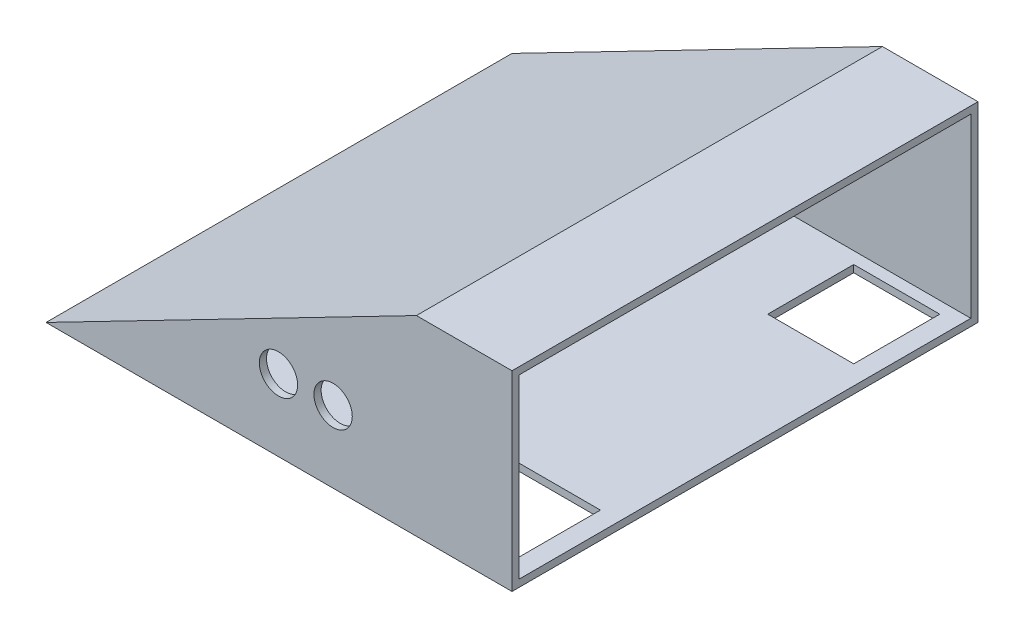
from build123d import *

# Parameters (mm, degrees)
ROBOT_DEPTH                 = 195
VACIO_POR_DENTRO_3MM_T      = -3
SKETCH3_R                   = 8.02
ULTRASONICO_DERECHA_DEPTH   = 3
SKETCH9_R                   = 8.2
ULTRASONICO_IZQUIERDA_DEPTH = 3
SKETCH10_W                  = 37
SKETCH10_H                  = 37
RUEDA_DERECHA_DEPTH         = 3
SKETCH12_W                  = 36
SKETCH12_H                  = 36
RUEDA_IZQUIERDA_DEPTH       = 3
SKETCH14_W                  = 7.4
SKETCH14_H                  = 7.4
CYN70_DERECHA_DEPTH         = 4
SKETCH15_W                  = 7.04
SKETCH15_H                  = 7.04
CNY70_CENTRO_DEPTH          = 4
SKETCH13_W                  = 7.4
SKETCH13_H                  = 7.4
CNY70_IZQUIERDA_DEPTH       = 4


with BuildPart() as part:
    # Sketch2 → Robot (new body)
    with BuildSketch(Plane.XY):
        Polygon((0, 0), (195, 0), (195, 80), (155, 80), align=None)
    extrude(amount=ROBOT_DEPTH)

    # Vacio por dentro 3mm
    vacio_por_dentro_3mm_openings = [part.faces().sort_by_distance(p)[0] for p in [
        (195, 40, 97.5),
    ]]
    offset(amount=VACIO_POR_DENTRO_3MM_T, openings=vacio_por_dentro_3mm_openings, kind=Kind.INTERSECTION)

    # Sketch3 → Ultrasonico Derecha (cut)
    with BuildSketch(Plane.XY.offset(195)):
        with Locations((97.289863967, 30)):
            Circle(SKETCH3_R)
        with Locations((120.139863967, 30)):
            Circle(SKETCH3_R)
    extrude(amount=-ULTRASONICO_DERECHA_DEPTH, mode=Mode.SUBTRACT)

    # Sketch9 → Ultrasonico Izquierda (cut)
    with BuildSketch(Plane(origin=(0, 0, 0), x_dir=(-1, 0, 0), z_dir=(0, 0, -1))):
        with Locations((-97.284004153, 30)):
            Circle(SKETCH9_R)
        with Locations((-120.134004153, 30)):
            Circle(SKETCH9_R)
    extrude(amount=-ULTRASONICO_IZQUIERDA_DEPTH, mode=Mode.SUBTRACT)

    # Sketch10 → Rueda Derecha (cut)
    with BuildSketch(Plane(origin=(0, 0, 0), x_dir=(-1, 0, 0), z_dir=(0, -1, 0))):
        with Locations((-168.5, -168.5)):
            Rectangle(SKETCH10_W, SKETCH10_H)
    extrude(amount=-RUEDA_DERECHA_DEPTH, mode=Mode.SUBTRACT)

    # Sketch12 → Rueda Izquierda (cut)
    with BuildSketch(Plane(origin=(0, 0, 0), x_dir=(-1, 0, 0), z_dir=(0, -1, 0))):
        with Locations((-169, -26)):
            Rectangle(SKETCH12_W, SKETCH12_H)
    extrude(amount=-RUEDA_IZQUIERDA_DEPTH, mode=Mode.SUBTRACT)

    # Sketch14 → Cyn70 Derecha (cut)
    with BuildSketch(Plane(origin=(0, 0, 0), x_dir=(-1, 0, 0), z_dir=(0, -1, 0))):
        with Locations((-18.7, -183.3)):
            Rectangle(SKETCH14_W, SKETCH14_H)
    extrude(amount=-CYN70_DERECHA_DEPTH, mode=Mode.SUBTRACT)

    # Sketch15 → Cny70 Centro (cut)
    with BuildSketch(Plane(origin=(0, 0, 0), x_dir=(-1, 0, 0), z_dir=(0, -1, 0))):
        with Locations((-18.52, -97.5)):
            Rectangle(SKETCH15_W, SKETCH15_H)
    extrude(amount=-CNY70_CENTRO_DEPTH, mode=Mode.SUBTRACT)

    # Sketch13 → Cny70 Izquierda (cut)
    with BuildSketch(Plane.XZ):
        with Locations((18.7, 11.7)):
            Rectangle(SKETCH13_W, SKETCH13_H)
    extrude(amount=-CNY70_IZQUIERDA_DEPTH, mode=Mode.SUBTRACT)


solid = part.part
